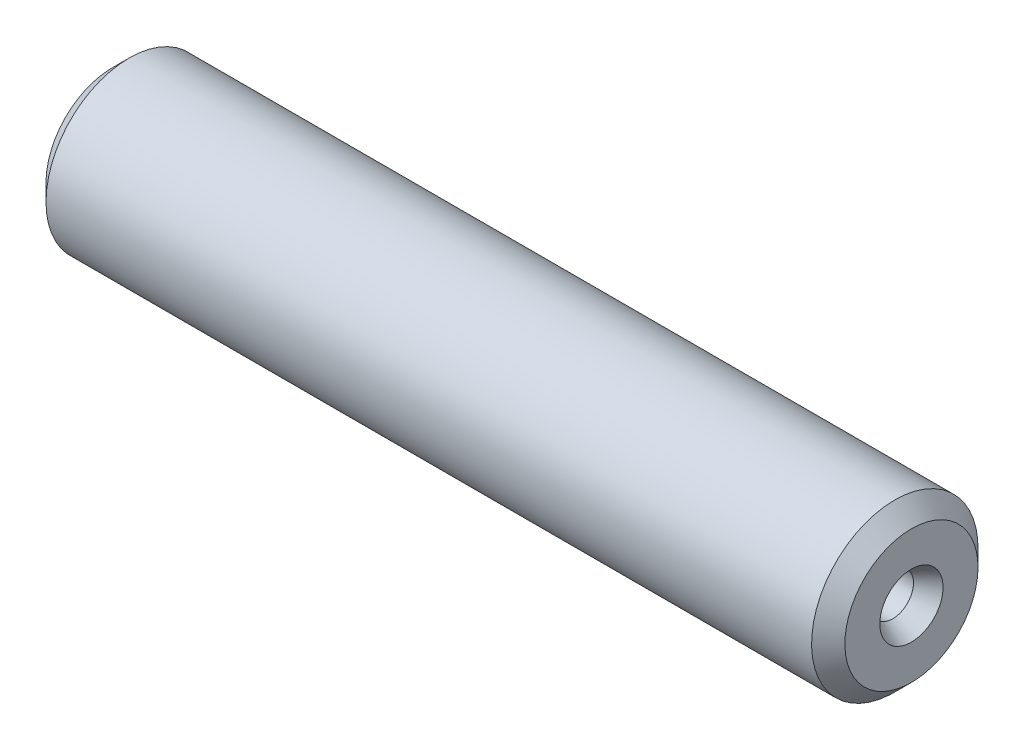
from build123d import *

# Parameters (mm, degrees)
CHAMFER1_SIZE = 1


with BuildPart() as part:
    # Sketch1 → Revolve1 (revolve)
    with BuildSketch(Plane.XY):
        Polygon((0, 1.9), (0, 5), (-48, 5), (-48, 0), (-4, 0), (-3.248924226, 1.25), (-1.125833025, 1.25), align=None)
    revolve(axis=Axis((0, 0, 0), (-1, 0, 0)))

    # Chamfer1
    chamfer1_edges = [part.edges().sort_by_distance(p)[0] for p in [
        (-48, -5, 0),
        (0, -5, 0),
    ]]
    chamfer(chamfer1_edges, length=CHAMFER1_SIZE)


solid = part.part
